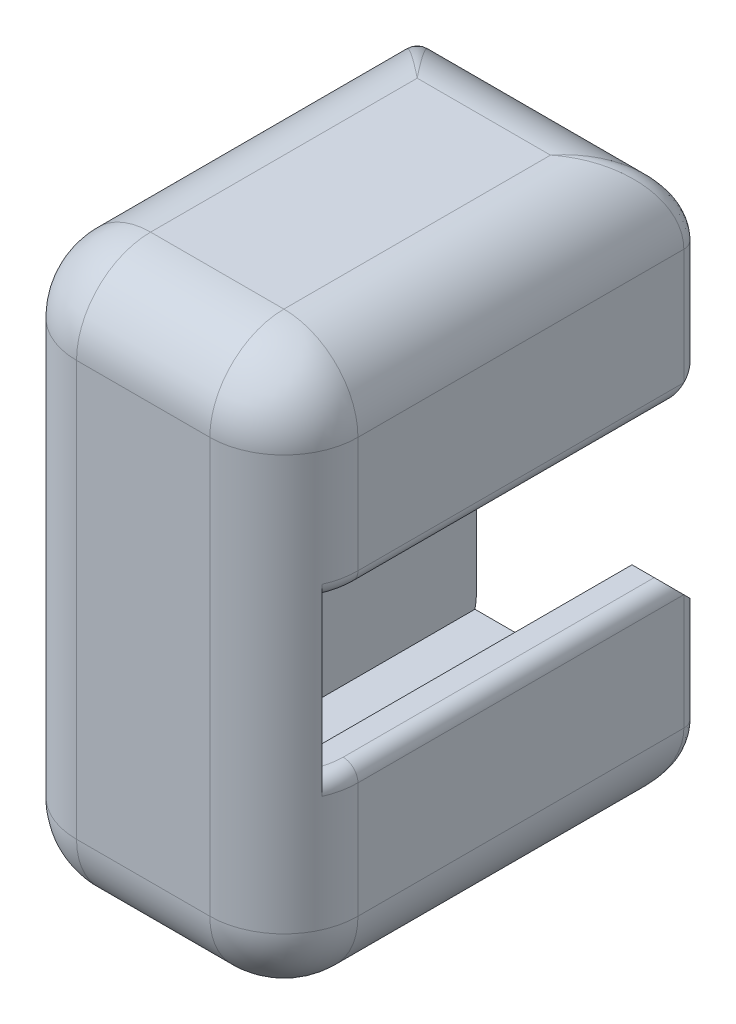
from build123d import *

# Parameters (mm, degrees)
SKETCH_1_W      = 19
SKETCH_1_H      = 38
EXTRUDE_1_DEPTH = 3
EXTRUDE_2_DEPTH = 25
SKETCH_5_W      = 25
SKETCH_5_H      = 9.8
EXTRUDE_3_DEPTH = 2.5
CHAMFER_1_SIZE  = 2
FILLET_2_R      = 5
FILLET_3_R      = 1
FILLET_4_R      = 1


# Some blends are built 0.0001 mm under size
with BuildPart() as part:
    # 草图1 → 凸台-拉伸1 (new body)
    with BuildSketch(Plane.XY):
        Rectangle(SKETCH_1_W, SKETCH_1_H)
    extrude(amount=EXTRUDE_1_DEPTH)

    # 草图2 → 凸台-拉伸2 (add)
    with BuildSketch(Plane(origin=(0, 0, 0), x_dir=(-1, 0, 0), z_dir=(0, 0, -1))):
        Polygon((-9.5, 19), (9.5, 19), (9.5, -19), (-9.5, -19), (-9.5, -15), (5.5, -15), (5.5, 15), (-9.5, 15), align=None)
    extrude(amount=EXTRUDE_2_DEPTH)

    # 草图5 → 凸台-拉伸3 (add)
    with BuildSketch(Plane(origin=(9.5, 0, 0), x_dir=(0, 0, -1), z_dir=(1, 0, 0))):
        with Locations((12.5, 10.1)):
            Rectangle(SKETCH_5_W, SKETCH_5_H)
        with Locations((12.5, -10.1)):
            Rectangle(SKETCH_5_W, SKETCH_5_H)
    extrude(amount=-EXTRUDE_3_DEPTH)

    # 倒角1
    chamfer_1_edges = [part.edges().sort_by_distance(p)[0] for p in [
        (8.25, 5.2, -25),
        (8.25, -5.2, -25),
    ]]
    chamfer(chamfer_1_edges, length=CHAMFER_1_SIZE)

    # 圆角2
    # the kernel refuses this fillet: 5 mm, written as the material it takes off along each edge
    with BuildSketch(Plane(origin=(4.5, -14, -2), x_dir=(0, -1, 0), z_dir=(1, 0, 0))) as fillet_2_piece_1_section:
        Polygon((0, 0), (FILLET_2_R, 0), (FILLET_2_R, -FILLET_2_R), (0, -FILLET_2_R), align=None)
    fillet_2_piece_1 = extrude(amount=FILLET_2_R, mode=Mode.PRIVATE)
    fillet_2_piece_1 = fillet_2_piece_1 - Plane(origin=(4.5, -14, -2), x_dir=(0, 0.7071067811865475, -0.7071067811865475), z_dir=(1, 0, 0)) * Sphere(FILLET_2_R, mode=Mode.PRIVATE)
    add(fillet_2_piece_1, mode=Mode.SUBTRACT)
    with BuildSketch(Plane(origin=(-4.5, -14, -2), x_dir=(0, -1, 0), z_dir=(-1, 0, 0))) as fillet_2_piece_2_section:
        Polygon((0, 0), (FILLET_2_R, 0), (FILLET_2_R, FILLET_2_R), (0, FILLET_2_R), align=None)
    fillet_2_piece_2 = extrude(amount=FILLET_2_R, mode=Mode.PRIVATE)
    fillet_2_piece_2 = fillet_2_piece_2 - Plane(origin=(-4.5, -14, -2), x_dir=(0, 0.7071067811865475, -0.7071067811865475), z_dir=(-1, 0, 0)) * Sphere(FILLET_2_R, mode=Mode.PRIVATE)
    add(fillet_2_piece_2, mode=Mode.SUBTRACT)
    with BuildSketch(Plane(origin=(-4.5, 14, -2), x_dir=(-1, 0, 0), z_dir=(0, 0, 1))) as fillet_2_piece_3_section:
        Polygon((0, 0), (FILLET_2_R, 0), (FILLET_2_R, -FILLET_2_R), (0, -FILLET_2_R), align=None)
    fillet_2_piece_3 = extrude(amount=FILLET_2_R, mode=Mode.PRIVATE)
    fillet_2_piece_3 = fillet_2_piece_3 - Plane(origin=(-4.5, 14, -2), x_dir=(0.7071067811865476, -0.7071067811865475, 0), z_dir=(0, 0, 1)) * Sphere(FILLET_2_R, mode=Mode.PRIVATE)
    add(fillet_2_piece_3, mode=Mode.SUBTRACT)
    with BuildSketch(Plane(origin=(4.5, 14, -2), x_dir=(0, 0, 1), z_dir=(1, 0, 0))) as fillet_2_piece_4_section:
        Polygon((0, 0), (FILLET_2_R, 0), (FILLET_2_R, -FILLET_2_R), (0, -FILLET_2_R), align=None)
    fillet_2_piece_4 = extrude(amount=FILLET_2_R, mode=Mode.PRIVATE)
    fillet_2_piece_4 = fillet_2_piece_4 - Plane(origin=(4.5, 14, -2), x_dir=(0, -0.7071067811865475, -0.7071067811865475), z_dir=(1, 0, 0)) * Sphere(FILLET_2_R, mode=Mode.PRIVATE)
    add(fillet_2_piece_4, mode=Mode.SUBTRACT)
    with BuildSketch(Plane(origin=(9.5, -19, -2), x_dir=(0, 1, 0), z_dir=(0, 0, -1))) as fillet_2_piece_5:
        with BuildLine():
            CenterArc((FILLET_2_R, -FILLET_2_R), FILLET_2_R, 90, 90)
            Line((0, -FILLET_2_R), (0, 0))
            Line((0, 0), (FILLET_2_R, 0))
        make_face()
    extrude(amount=35.5, mode=Mode.SUBTRACT)
    with BuildSketch(Plane(origin=(-22, -19, -25), x_dir=(0, 1, 0), z_dir=(1, 0, 0)), Plane(origin=(22, 19, -25), x_dir=(0, -1, 0), z_dir=(-1, 0, 0))) as fillet_2_piece_6:
        with BuildLine():
            CenterArc((FILLET_2_R, FILLET_2_R), FILLET_2_R, 180, 90)
            Line((0, FILLET_2_R), (0, 0))
            Line((0, 0), (FILLET_2_R, 0))
        make_face()
    extrude(amount=44, mode=Mode.SUBTRACT)
    with BuildSketch(Plane(origin=(4.5, -19, 3), x_dir=(0, 0, -1), z_dir=(-1, 0, 0)), Plane(origin=(-4.5, 19, 3), x_dir=(0, 0, -1), z_dir=(1, 0, 0))) as fillet_2_piece_7:
        with BuildLine():
            CenterArc((FILLET_2_R, -FILLET_2_R), FILLET_2_R, 90, 90)
            Line((0, -FILLET_2_R), (0, 0))
            Line((0, 0), (FILLET_2_R, 0))
        make_face()
    extrude(amount=9, mode=Mode.SUBTRACT)
    with BuildSketch(Plane(origin=(-9.5, -19, -37.5), x_dir=(1, 0, 0), z_dir=(0, 0, 1)), Plane(origin=(-9.5, 19, -37.5), x_dir=(0, -1, 0), z_dir=(0, 0, 1)), Plane(origin=(9.5, 19, -2), x_dir=(0, -1, 0), z_dir=(0, 0, -1))) as fillet_2_piece_8:
        with BuildLine():
            CenterArc((FILLET_2_R, FILLET_2_R), FILLET_2_R, 180, 90)
            Line((0, FILLET_2_R), (0, 0))
            Line((0, 0), (FILLET_2_R, 0))
        make_face()
    extrude(amount=35.5, mode=Mode.SUBTRACT)
    with BuildSketch(Plane(origin=(-9.5, -14, 3), x_dir=(0, 0, -1), z_dir=(0, 1, 0)), Plane(origin=(9.5, 14, 3), x_dir=(0, 0, -1), z_dir=(0, -1, 0))) as fillet_2_piece_9:
        with BuildLine():
            CenterArc((FILLET_2_R, -FILLET_2_R), FILLET_2_R, 90, 90)
            Line((0, -FILLET_2_R), (0, 0))
            Line((0, 0), (FILLET_2_R, 0))
        make_face()
    extrude(amount=28, mode=Mode.SUBTRACT)

    # 圆角3
    fillet_3_edges = [part.edges().sort_by_distance(p)[0] for p in [
        (-7.730244537, 17.816480084, -23.230244537),
        (-7.730244537, -17.816480084, -23.230244537),
        (-9.5, 0, -25),
    ]]
    fillet(fillet_3_edges, radius=FILLET_3_R)

    # 圆角4
    fillet_4_edges = [part.edges().sort_by_distance(p)[0] for p in [
        (9.394531565, 5.2, -0.978451782),
        (9.394531565, -5.2, -0.978451782),
        (8.035533906, 17.535533906, -23.535533906),
        (8.035533906, -17.535533906, -23.535533906),
        (9.5, -10.6, -25),
        (9.5, -5.2, -12.5),
        (9.5, 5.2, -12.5),
        (9.5, 10.6, -25),
    ]]
    fillet(fillet_4_edges, radius=FILLET_4_R - 0.0001)  # a hair under: the kernel refuses the full size


solid = part.part
